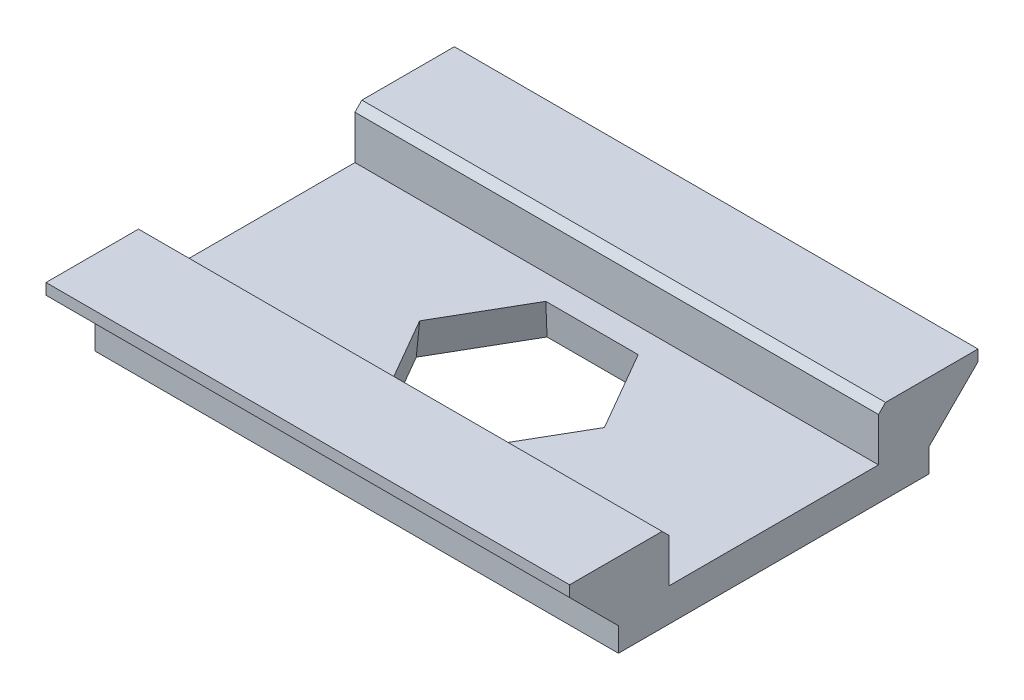
from build123d import *

# Parameters (mm, degrees)
BOSS_EXTRUDE1_DEPTH = 7.5
CUT_EXTRUDE2_DEPTH  = 10.809816512
CUT_EXTRUDE2_DRAFT  = 5
CHAMFER1_SIZE       = 0.2


with BuildPart() as part:
    # Retainer Profile → Boss-Extrude1 (new, symmetric)
    with BuildSketch(Plane(origin=(0, 0, 0), x_dir=(0, 0, -1), z_dir=(1, 0, 0))):
        Polygon((-5.05, 4.592304845), (-5.85, 4.592304845), (-5.85, 4.275147558), (-4.45, 2.875147558), (-4.45, 2.192304845), (4.45, 2.192304845), (4.45, 2.875147558), (5.85, 4.275147558), (5.85, 4.592304845), (5.05, 4.592304845), (3, 4.592304845), (3, 3.142304845), (-3, 3.142304845), (-3, 4.592304845), align=None)
    extrude(amount=BOSS_EXTRUDE1_DEPTH, both=True)


with BuildPart() as cut_extrude2_tool:
    # Sketch3 → Cut-Extrude2 (with draft: the straight prism first)
    with BuildSketch(Plane(origin=(0, 4.592304845, 0), x_dir=(1, 0, 0), z_dir=(0, 1, 0))):
        Polygon((2.5, 0), (1.25, 2.165063509), (-1.25, 2.165063509), (-2.5, 0), (-1.25, -2.165063509), (1.25, -2.165063509), align=None)
    extrude(amount=-CUT_EXTRUDE2_DEPTH)
    # Cut-Extrude2: the draft: its side faces are tilted about the plane it starts from
    cut_extrude2_sides = [cut_extrude2_tool.faces().sort_by_distance(p)[0] for p in [
        (1.875, -0.812603411, -1.082531755),
        (0, -0.812603411, -2.165063509),
        (-1.875, -0.812603411, -1.082531755),
        (-1.875, -0.812603411, 1.082531755),
        (0, -0.812603411, 2.165063509),
        (1.875, -0.812603411, 1.082531755),
    ]]
    draft(cut_extrude2_sides, Plane(origin=(0, 4.592304845, 0), x_dir=(1, 0, 0), z_dir=(0, 1, 0)), CUT_EXTRUDE2_DRAFT)


with BuildPart() as part_1:
    add(part.part)

    # Cut-Extrude2: cut by cut_extrude2_tool
    add(cut_extrude2_tool.part, mode=Mode.SUBTRACT)

    # Chamfer1
    chamfer1_edges = [part_1.edges().sort_by_distance(p)[0] for p in [
        (0, 4.592304845, 3),
        (0, 4.592304845, -3),
    ]]
    chamfer(chamfer1_edges, length=CHAMFER1_SIZE)


solid = part_1.part
